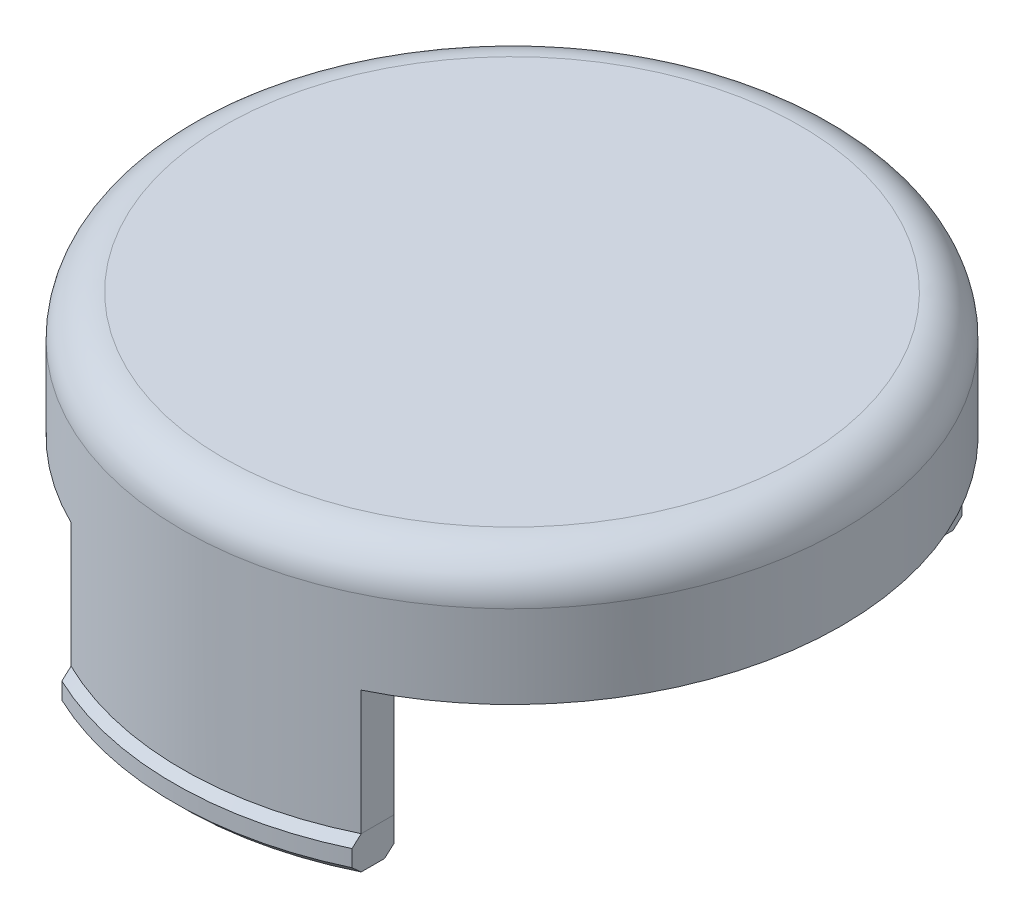
from build123d import *

# Parameters (mm, degrees)
SKETCH_2_R               = 7.95
EXTRUDE_1_DEPTH          = 4
SKETCH_4_R               = 8.15
EXTRUDE_2_DEPTH          = 0.8
SKETCH_3_R               = 7.25
CUT_EXTRUDE_2_DEPTH      = 3.8
CHAMFER_2_SIZE           = 0.2
CUT_EXTRUDE_3_DEPTH      = 13.200204916
CUT_EXTRUDE_3_DEPTH_BACK = 13.200204916
SKETCH_5_W               = 6.5
SKETCH_5_H               = 8
SKETCH_6_R               = 7.95
EXTRUDE_3_DEPTH          = 2
FILLET_1_R               = 1
SKETCH_7_R               = 6.5
CUT_EXTRUDE_4_DEPTH      = 1


with BuildPart() as part:
    # 草图2 → 凸台-拉伸1 (new body)
    with BuildSketch(Plane(origin=(0, 0, 0), x_dir=(1, 0, 0), z_dir=(0, 1, 0))):
        Circle(SKETCH_2_R)
    extrude(amount=EXTRUDE_1_DEPTH)


with BuildPart() as body_2:
    # 草图4 → 凸台-拉伸2 (new body)
    with BuildSketch(Plane.XZ):
        Circle(SKETCH_4_R)
    extrude(amount=EXTRUDE_2_DEPTH)


with BuildPart() as cut_extrude_2_tool:
    # 草图3 → 切除-拉伸2 (new body)
    with BuildSketch(Plane.XZ.offset(0.8)):
        Circle(SKETCH_3_R)
    extrude(amount=-CUT_EXTRUDE_2_DEPTH)


with BuildPart() as part_1:
    add(part.part)

    # 切除-拉伸2: cut by cut_extrude_2_tool
    add(cut_extrude_2_tool.part, mode=Mode.SUBTRACT)


with BuildPart() as body_2_1:
    add(body_2.part)

    # 切除-拉伸2: cut by cut_extrude_2_tool
    add(cut_extrude_2_tool.part, mode=Mode.SUBTRACT)

    # 倒角2
    chamfer_2_edges = [body_2_1.edges().sort_by_distance(p)[0] for p in [
        (-7.25, -0.8, 0),
        (-8.15, -0.8, 0),
        (-8.15, 0, 0),
    ]]
    chamfer(chamfer_2_edges, length=CHAMFER_2_SIZE)


with BuildPart() as cut_extrude_3_tool:
    # 草图5 → 切除-拉伸3 (new, two sides: drawn at the far end of the back side and taken through both)
    with BuildSketch(Plane.XY.offset(-CUT_EXTRUDE_3_DEPTH_BACK)):
        with Locations((-6.75, -1)):
            Rectangle(SKETCH_5_W, SKETCH_5_H)
        with Locations((6.75, -1)):
            Rectangle(SKETCH_5_W, SKETCH_5_H)
    extrude(amount=CUT_EXTRUDE_3_DEPTH + CUT_EXTRUDE_3_DEPTH_BACK)


with BuildPart() as part_2:
    add(part_1.part)

    # 切除-拉伸3: cut by cut_extrude_3_tool
    add(cut_extrude_3_tool.part, mode=Mode.SUBTRACT)

    # 草图6 → 凸台-拉伸3 (add)
    with BuildSketch(Plane(origin=(0, 4, 0), x_dir=(1, 0, 0), z_dir=(0, 1, 0))):
        Circle(SKETCH_6_R)
    extrude(amount=EXTRUDE_3_DEPTH)

    # 圆角1
    fillet_1_edges = [part_2.edges().sort_by_distance(p)[0] for p in [
        (-7.95, 6, 0),
    ]]
    fillet(fillet_1_edges, radius=FILLET_1_R)

    # 草图7 → 切除-拉伸4 (cut)
    with BuildSketch(Plane.XZ.offset(-3)):
        Circle(SKETCH_7_R)
    extrude(amount=-CUT_EXTRUDE_4_DEPTH, mode=Mode.SUBTRACT)


with BuildPart() as body_2_2:
    add(body_2_1.part)

    # 切除-拉伸3: cut by cut_extrude_3_tool
    add(cut_extrude_3_tool.part, mode=Mode.SUBTRACT)


solid = Compound([part_2.part, body_2_2.part])
